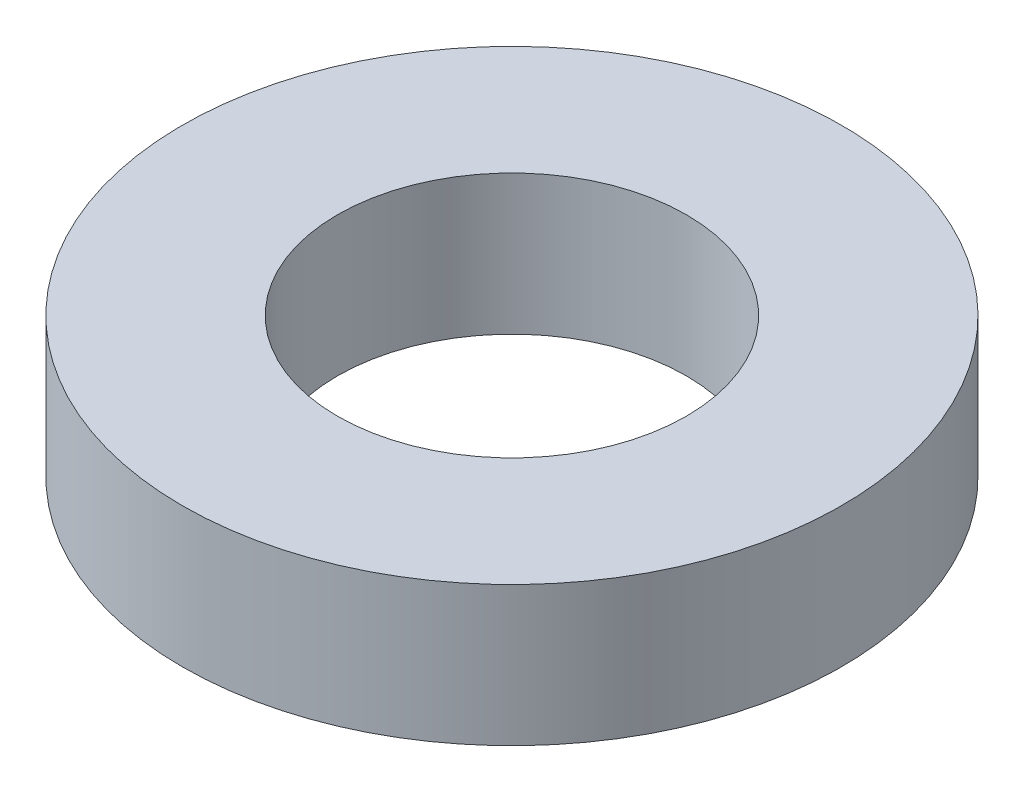
from build123d import *

# Parameters (mm, degrees)
SKETCH1_R           = 42.5
BOSS_EXTRUDE1_DEPTH = 18
SKETCH2_R           = 22.5
CUT_EXTRUDE1_DEPTH  = 63.741533293


with BuildPart() as part:
    # Sketch1 → Boss-Extrude1 (new body)
    with BuildSketch(Plane(origin=(0, 0, 0), x_dir=(1, 0, 0), z_dir=(0, 1, 0))):
        Circle(SKETCH1_R)
    extrude(amount=BOSS_EXTRUDE1_DEPTH)

    # Sketch2 → Cut-Extrude1 (cut, through all)
    with BuildSketch(Plane(origin=(0, 0, 0), x_dir=(1, 0, 0), z_dir=(0, 1, 0))):
        Circle(SKETCH2_R)
    extrude(amount=CUT_EXTRUDE1_DEPTH, mode=Mode.SUBTRACT)


solid = part.part
